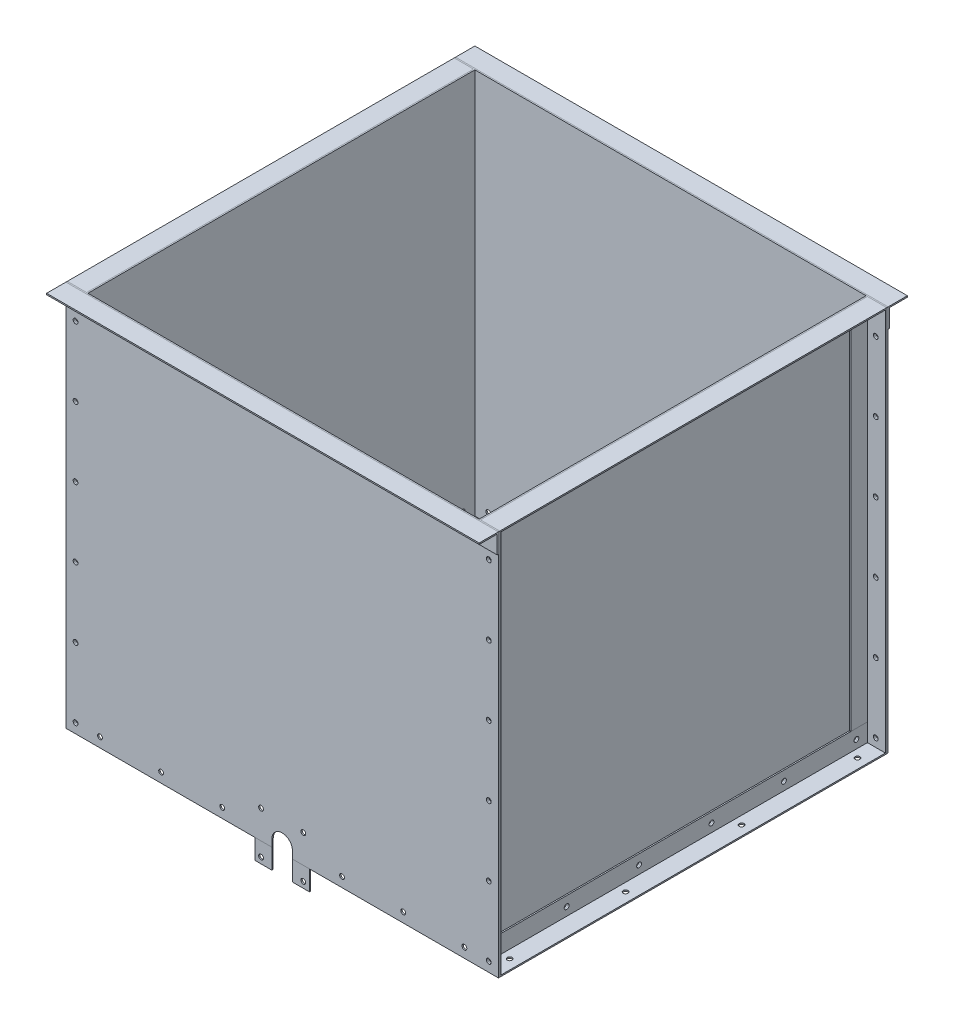
from build123d import *

# Parameters (mm, degrees)
ESBO_O1_R                  = 6.35
FLANGE_BASE1_DEPTH         = 3.5
PADR_O_LINEAR1_COUNT       = 2
PADR_O_LINEAR1_PITCH       = 1021
ESBO_O8_W                  = 3.5
ESBO_O8_H                  = 1017.5
RESSALTO_EXTRUS_O1_DEPTH   = 1016
RESSALTO_EXTRUS_O2_DEPTH   = 1017.5
ESBO_O12_R                 = 6.35
CORTE_EXTRUS_O2_DEPTH      = 10
ESBO_O13_W                 = 3.5
ESBO_O13_H                 = 47.3
RESSALTO_EXTRUS_O4_DEPTH   = 965.2
RESSALTO_EXTRUS_O4_2_DEPTH = 965.2
RESSALTO_EXTRUS_O5_DEPTH   = 1137.3
RESSALTO_EXTRUS_O6_DEPTH   = 1017.5
ESBO_O16_W                 = 1017.5
ESBO_O16_H                 = 50.8
CORTE_EXTRUS_O3_DEPTH      = 3.5
ESBO_O17_W                 = 1017.5
ESBO_O17_H                 = 50.8
CORTE_EXTRUS_O4_DEPTH      = 3.5
ESBO_O18_W                 = 47.3
ESBO_O18_H                 = 1009
ESBO_O18_R                 = 6.35
RESSALTO_EXTRUS_O7_DEPTH   = 3.5
ESBO_O19_R                 = 6.35
ESBO_O19_R_2               = 6.351024484
CORTE_EXTRUS_O5_DEPTH      = 3.5
ESBO_O20_R                 = 6.35
CORTE_EXTRUS_O6_DEPTH      = 10
ESBO_O22_W                 = 44.437670455
ESBO_O22_H                 = 52.387670455
ESBO_O22_R                 = 6.35
ABA1_DEPTH                 = 3.5
CORTE_EXTRUS_O7_REACH      = 1574.75
ESBO_O31_R                 = 6.35


# Sheet-metal steps are written as plain solids
with BuildPart() as part:
    # Esboço1 → Flange-base1 (new body)
    with BuildSketch(Plane.XY):
        with BuildLine():
            Line((568.65, -19.05), (568.65, 996.95))
            Line((568.65, 996.95), (-568.65, 996.95))
            Line((-568.65, 996.95), (-568.65, -19.05))
            Line((-568.65, -19.05), (-27, -19.05))
            Line((-27, -19.05), (-27, 0))
            ThreePointArc((-27, 0), (0, 27), (27, 0))
            Line((27, 0), (27, -19.05))
            Line((27, -19.05), (568.65, -19.05))
        make_face()
        with Locations((157.536, 6.35)):
            Circle(ESBO_O1_R, mode=Mode.SUBTRACT)
        with Locations((318.318, 6.35)):
            Circle(ESBO_O1_R, mode=Mode.SUBTRACT)
        with Locations((479.1, 6.35)):
            Circle(ESBO_O1_R, mode=Mode.SUBTRACT)
        with Locations(Location((-479.1, 6.35, 0), (0, 0, 180))):
            Circle(ESBO_O1_R, mode=Mode.SUBTRACT)
        with Locations(Location((-318.318, 6.35, 0), (0, 0, 180))):
            Circle(ESBO_O1_R, mode=Mode.SUBTRACT)
        with Locations(Location((-157.536, 6.35, 0), (0, 0, 180))):
            Circle(ESBO_O1_R, mode=Mode.SUBTRACT)
        with Locations((543.25, 6.35)):
            Circle(ESBO_O1_R, mode=Mode.SUBTRACT)
        with Locations((543.25, 189.23)):
            Circle(ESBO_O1_R, mode=Mode.SUBTRACT)
        with Locations((543.25, 372.11)):
            Circle(ESBO_O1_R, mode=Mode.SUBTRACT)
        with Locations((543.25, 554.99)):
            Circle(ESBO_O1_R, mode=Mode.SUBTRACT)
        with Locations((543.25, 737.87)):
            Circle(ESBO_O1_R, mode=Mode.SUBTRACT)
        with Locations((543.25, 920.75)):
            Circle(ESBO_O1_R, mode=Mode.SUBTRACT)
        with Locations(Location((-543.25, 920.75, 0), (0, 0, 180))):
            Circle(ESBO_O1_R, mode=Mode.SUBTRACT)
        with Locations(Location((-543.25, 737.87, 0), (0, 0, 180))):
            Circle(ESBO_O1_R, mode=Mode.SUBTRACT)
        with Locations(Location((-543.25, 554.99, 0), (0, 0, 180))):
            Circle(ESBO_O1_R, mode=Mode.SUBTRACT)
        with Locations(Location((-543.25, 372.11, 0), (0, 0, 180))):
            Circle(ESBO_O1_R, mode=Mode.SUBTRACT)
        with Locations(Location((-543.25, 189.23, 0), (0, 0, 180))):
            Circle(ESBO_O1_R, mode=Mode.SUBTRACT)
        with Locations(Location((-543.25, 6.35, 0), (0, 0, 180))):
            Circle(ESBO_O1_R, mode=Mode.SUBTRACT)
    extrude(amount=-FLANGE_BASE1_DEPTH)


with BuildPart() as padr_o_linear1_1:
    # Padrão linear1: pattern copy
    add(part.part.moved(Location(Vector(0, 0, -1) * (1 * PADR_O_LINEAR1_PITCH))))


with BuildPart() as part_1:
    add(part.part)

    add(padr_o_linear1_1.part)  # Ressalto-extrusão1 merges Padrão linear1_1
    # Esboço8 → Ressalto-extrusão1 (add)
    with BuildSketch(Plane(origin=(0, 996.95, 0), x_dir=(1, 0, 0), z_dir=(0, 1, 0))):
        with Locations((516.1, 512.25)):
            Rectangle(ESBO_O8_W, ESBO_O8_H)
        with Locations((-516.1, 512.25)):
            Rectangle(ESBO_O8_W, ESBO_O8_H)
    extrude(amount=-RESSALTO_EXTRUS_O1_DEPTH)


with BuildPart() as body_2:
    # Esboço11 → Ressalto-extrusão2 (new body)
    with BuildSketch(Plane.XY.offset(-1021)):
        Polygon((517.85, 31.75), (521.35, 31.75), (521.35, -15.55), (568.65, -15.55), (568.65, -19.05), (517.85, -19.05), align=None)
    ressalto_extrus_o2 = extrude(amount=RESSALTO_EXTRUS_O2_DEPTH)


with BuildPart() as corte_extrus_o2_tool:
    # Esboço12 → Corte-extrusão2 (new body)
    with BuildSketch(Plane(origin=(521.35, 0, 0), x_dir=(0, 0, -1), z_dir=(1, 0, 0))):
        with Locations((417, 6.35)):
            Circle(ESBO_O12_R)
        with Locations((226.5, 6.35)):
            Circle(ESBO_O12_R)
        with Locations((36, 6.35)):
            Circle(ESBO_O12_R)
        with Locations((988.5, 6.35)):
            Circle(ESBO_O12_R)
        with Locations((798, 6.35)):
            Circle(ESBO_O12_R)
        with Locations((607.5, 6.35)):
            Circle(ESBO_O12_R)
    corte_extrus_o2 = extrude(amount=-CORTE_EXTRUS_O2_DEPTH)


with BuildPart() as part_2:
    add(part_1.part)

    # Corte-extrusão2: cut by corte_extrus_o2_tool
    add(corte_extrus_o2_tool.part, mode=Mode.SUBTRACT)

    # Espelhar2: Ressalto-extrusão2, Corte-extrusão2 across plane
    add(ressalto_extrus_o2.mirror(Plane(origin=(0, 0, 0), x_dir=(0, 0, 1), z_dir=(1, 0, 0))))
    add(corte_extrus_o2.mirror(Plane(origin=(0, 0, 0), x_dir=(0, 0, 1), z_dir=(1, 0, 0))), mode=Mode.SUBTRACT)


with BuildPart() as body_2_1:
    add(body_2.part)

    # Corte-extrusão2: cut by corte_extrus_o2_tool
    add(corte_extrus_o2_tool.part, mode=Mode.SUBTRACT)


with BuildPart() as body_3:
    # Esboço13 → Ressalto-extrusão4 (new body)
    with BuildSketch(Plane(origin=(0, 996.95, 0), x_dir=(1, 0, 0), z_dir=(0, 1, 0))):
        with Locations((519.6, 997.35)):
            Rectangle(ESBO_O13_W, ESBO_O13_H)
    ressalto_extrus_o4 = extrude(amount=-RESSALTO_EXTRUS_O4_DEPTH)


with BuildPart() as body_4:
    # Esboço13 → Ressalto-extrus_o4 2 (new body)
    with BuildSketch(Plane(origin=(0, 996.95, 0), x_dir=(1, 0, 0), z_dir=(0, 1, 0))):
        with Locations((519.6, 27.15)):
            Rectangle(ESBO_O13_W, ESBO_O13_H)
    ressalto_extrus_o4_2 = extrude(amount=-RESSALTO_EXTRUS_O4_2_DEPTH)


with BuildPart() as part_3:
    add(part_2.part)

    # Espelhar3: Ressalto-extrusão4, Ressalto-extrus_o4 2 across plane
    add(ressalto_extrus_o4.mirror(Plane(origin=(0, 0, 0), x_dir=(0, 0, 1), z_dir=(1, 0, 0))))
    add(ressalto_extrus_o4_2.mirror(Plane(origin=(0, 0, 0), x_dir=(0, 0, 1), z_dir=(1, 0, 0))))

    # Esboço17 → Corte-extrusão4 (cut)
    with BuildSketch(Plane.ZY.offset(521.35)):
        with Locations((-512.25, 971.55)):
            Rectangle(ESBO_O17_W, ESBO_O17_H)
    extrude(amount=-CORTE_EXTRUS_O4_DEPTH, mode=Mode.SUBTRACT)


with BuildPart() as body_5:
    # Esboço14 → Ressalto-extrusão5 (new body)
    with BuildSketch(Plane(origin=(568.65, 0, 0), x_dir=(0, 0, -1), z_dir=(1, 0, 0))):
        Polygon((0, 996.95), (0, 946.15), (-3.5, 946.15), (-3.5, 993.45), (-50.8, 993.45), (-50.8, 996.95), align=None)
    extrude(amount=-RESSALTO_EXTRUS_O5_DEPTH)


with BuildPart() as body_6:
    # Esboço15 → Ressalto-extrusão6 (new body)
    with BuildSketch(Plane(origin=(0, 0, -3.5), x_dir=(-1, 0, 0), z_dir=(0, 0, -1))):
        Polygon((-517.85, 996.95), (-568.65, 996.95), (-568.65, 993.45), (-521.35, 993.45), (-521.35, 946.15), (-517.85, 946.15), align=None)
    extrude(amount=RESSALTO_EXTRUS_O6_DEPTH)


with BuildPart() as corte_extrus_o3_tool:
    # Esboço16 → Corte-extrusão3 (new body)
    with BuildSketch(Plane(origin=(521.35, 0, 0), x_dir=(0, 0, -1), z_dir=(1, 0, 0))):
        with Locations((512.25, 971.55)):
            Rectangle(ESBO_O16_W, ESBO_O16_H)
    extrude(amount=-CORTE_EXTRUS_O3_DEPTH)


with BuildPart() as body_3_1:
    add(body_3.part)

    # Corte-extrusão3: cut by corte_extrus_o3_tool
    add(corte_extrus_o3_tool.part, mode=Mode.SUBTRACT)


with BuildPart() as body_4_1:
    add(body_4.part)

    # Corte-extrusão3: cut by corte_extrus_o3_tool
    add(corte_extrus_o3_tool.part, mode=Mode.SUBTRACT)


with BuildPart() as body_7:
    # Espelhar7: mirrored copy
    add(body_6.part.mirror(Plane(origin=(0, 0, 0), x_dir=(0, 0, 1), z_dir=(1, 0, 0))))


with BuildPart() as body_8:
    # Espelhar8: mirrored copy
    add(body_5.part.mirror(Plane.XY.offset(-512.25)))


with BuildPart() as body_9:
    # Esboço18 → Ressalto-extrusão7 (new body)
    with BuildSketch(Plane(origin=(0, 0, -3.5), x_dir=(-1, 0, 0), z_dir=(0, 0, -1))):
        with Locations((-545, 488.95)):
            Rectangle(ESBO_O18_W, ESBO_O18_H)
        with Locations((-543.25, 6.35)):
            Circle(ESBO_O18_R, mode=Mode.SUBTRACT)
        with Locations((-543.25, 189.23)):
            Circle(ESBO_O18_R, mode=Mode.SUBTRACT)
        with Locations((-543.25, 372.11)):
            Circle(ESBO_O18_R, mode=Mode.SUBTRACT)
        with Locations((-543.25, 554.99)):
            Circle(ESBO_O18_R, mode=Mode.SUBTRACT)
        with Locations((-543.25, 737.87)):
            Circle(ESBO_O18_R, mode=Mode.SUBTRACT)
        with Locations((-543.25, 920.75)):
            Circle(ESBO_O18_R, mode=Mode.SUBTRACT)
    extrude(amount=RESSALTO_EXTRUS_O7_DEPTH)


with BuildPart() as body_10:
    # Espelhar9: mirrored copy
    add(body_9.part.mirror(Plane.XY.offset(-512.25)))


with BuildPart() as body_11:
    # Espelhar10: mirrored copy
    add(body_9.part.mirror(Plane.ZY))


with BuildPart() as body_12:
    # Espelhar10 2: mirrored copy
    add(body_10.part.mirror(Plane.ZY))


with BuildPart() as corte_extrus_o5_tool:
    # Esboço19 → Corte-extrusão5 (new body)
    with BuildSketch(Plane(origin=(0, -15.55, 0), x_dir=(1, 0, 0), z_dir=(0, 1, 0))):
        with Locations(Location((-543.25, 969.45, 0), (0, 0, 270))):
            Circle(ESBO_O19_R)
        with Locations(Location((-543.25, 664.651024484, 0), (0, 0, 270))):
            Circle(ESBO_O19_R_2)
        with Locations(Location((-543.25, 359.848975516, 0), (0, 0, 270))):
            Circle(ESBO_O19_R_2)
        with Locations(Location((-543.25, 55.05, 0), (0, 0, 270))):
            Circle(ESBO_O19_R)
        with Locations(Location((543.25, 55.05, 0), (0, 0, 180))):
            Circle(ESBO_O19_R)
        with Locations(Location((543.25, 359.848975516, 0), (0, 0, 180))):
            Circle(ESBO_O19_R_2)
        with Locations(Location((543.25, 664.651024484, 0), (0, 0, 180))):
            Circle(ESBO_O19_R_2)
        with Locations(Location((543.25, 969.45, 0), (0, 0, 180))):
            Circle(ESBO_O19_R)
    extrude(amount=-CORTE_EXTRUS_O5_DEPTH)


with BuildPart() as part_4:
    add(part_3.part)

    # Corte-extrusão5: cut by corte_extrus_o5_tool
    add(corte_extrus_o5_tool.part, mode=Mode.SUBTRACT)

    # Esboço20 → Corte-extrusão6 (cut)
    with BuildSketch(Plane.XY):
        with Locations((-55.562329545, 55.562329545)):
            Circle(ESBO_O20_R)
        with Locations((55.562329545, 55.562329545)):
            Circle(ESBO_O20_R)
    extrude(amount=-CORTE_EXTRUS_O6_DEPTH, mode=Mode.SUBTRACT)

    # Corte-extrusão7: up to this face of the body (flat: up to its plane)
    corte_extrus_o7_end = Plane(part_4.part.faces().sort_by_distance((0, 490.318432827, 0))[0])
    # Esboço31 → Corte-extrusão7 (cut, up to the picked face)
    with BuildSketch(Plane(origin=(0, 0, -1024.5), x_dir=(-1, 0, 0), z_dir=(0, 0, -1)), mode=Mode.PRIVATE) as corte_extrus_o7_sk1:
        with Locations((55.5625, 55.5625)):
            Circle(ESBO_O31_R)
    corte_extrus_o7_tool1 = split(extrude(corte_extrus_o7_sk1.sketch, amount=-CORTE_EXTRUS_O7_REACH, mode=Mode.PRIVATE), bisect_by=corte_extrus_o7_end, keep=Keep.BOTH, mode=Mode.PRIVATE)
    # Esboço31 → Corte-extrusão7 (cut, up to the picked face)
    with BuildSketch(Plane(origin=(0, 0, -1024.5), x_dir=(-1, 0, 0), z_dir=(0, 0, -1)), mode=Mode.PRIVATE) as corte_extrus_o7_sk2:
        with Locations((-55.5625, 55.5625)):
            Circle(ESBO_O31_R)
    corte_extrus_o7_tool2 = split(extrude(corte_extrus_o7_sk2.sketch, amount=-CORTE_EXTRUS_O7_REACH, mode=Mode.PRIVATE), bisect_by=corte_extrus_o7_end, keep=Keep.BOTH, mode=Mode.PRIVATE)
    add(corte_extrus_o7_tool1.solids().sort_by(Axis((-55.5625, 55.5625, -1024.5), (0, 0, 1)))[0], mode=Mode.SUBTRACT)
    add(corte_extrus_o7_tool2.solids().sort_by(Axis((55.5625, 55.5625, -1024.5), (0, 0, 1)))[0], mode=Mode.SUBTRACT)


with BuildPart() as body_2_2:
    add(body_2_1.part)

    # Corte-extrusão5: cut by corte_extrus_o5_tool
    add(corte_extrus_o5_tool.part, mode=Mode.SUBTRACT)


with BuildPart() as body_13:
    # Esboço22 → Aba1 (new body)
    with BuildSketch(Plane.XY):
        with Locations((-49.218835228, -45.243835227)):
            Rectangle(ESBO_O22_W, ESBO_O22_H)
        with Locations((-55.562329545, -55.562329545)):
            Circle(ESBO_O22_R, mode=Mode.SUBTRACT)
    extrude(amount=-ABA1_DEPTH)


with BuildPart() as body_14:
    # Espelhar11: mirrored copy
    add(body_13.part.mirror(Plane(origin=(0, 0, 0), x_dir=(0, 0, 1), z_dir=(1, 0, 0))))


with BuildPart() as body_15:
    # Espelhar12: mirrored copy
    add(body_13.part.mirror(Plane.XY.offset(-512.25)))


with BuildPart() as body_16:
    # Espelhar12 2: mirrored copy
    add(body_14.part.mirror(Plane.XY.offset(-512.25)))


solid = Compound([body_5.part, body_6.part, body_3_1.part, body_4_1.part, body_7.part, body_8.part, body_9.part, body_10.part, body_11.part, body_12.part, part_4.part, body_2_2.part, body_13.part, body_14.part, body_15.part, body_16.part])
